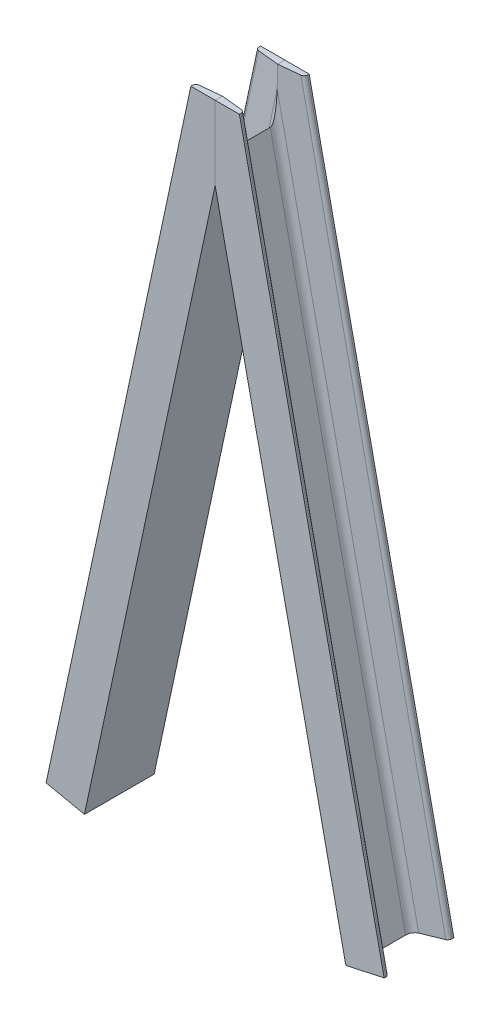
from build123d import *

# Parameters (mm, degrees)
C_START                               = -31.42936331
C_CHANNEL_CONFIGURED_80_X_8_1_DEPTH   = 715.891053164
C_CHANNEL_CONFIGURED_80_X_8_1_2_DEPTH = 80
C_START_2                             = 684.461689854
C_CHANNEL_CONFIGURED_80_X_8_1_3_DEPTH = 210.538310146
C_START_3                             = -684.461689854
C_CHANNEL_CONFIGURED_80_X_8_1_4_DEPTH = 715.891053164
C_CHANNEL_CONFIGURED_80_X_8_1_5_DEPTH = 80
C_START_4                             = -895
C_CHANNEL_CONFIGURED_80_X_8_1_6_DEPTH = 210.538310146
SKETCH12_W                            = 228.035854542
SKETCH12_H                            = 149.852132985
CUT_EXTRUDE1_DEPTH                    = 939.528461201


with BuildPart() as part:
    # C channel - configured 80 X 8(1): read off the stored shape, not the designer's step
    # C channel - configured 80 X 8(1) outline → C channel - configured 80 X 8(1) (new body)
    with BuildSketch(Plane(origin=(0, 0, 0), x_dir=(0.9778024140774096, -0.20952908873087298, 0), z_dir=(0.20952908873087295, 0.9778024140774098, 0)).offset(C_START)):
        with BuildLine():
            ThreePointArc((-188.088475965, -74.199337243), (-190.642941414, -75.500902399), (-191.670362112, -78.177424825))
            Line((-191.670362112, -78.177424825), (-191.670362112, -80))
            Line((-191.670362112, -80), (-146.670362112, -80))
            Line((-146.670362112, -80), (-146.670362112, 0))
            Line((-146.670362112, 0), (-191.670362112, 0))
            Line((-191.670362112, 0), (-191.670362112, -1.822575175))
            ThreePointArc((-191.670362112, -1.822575175), (-190.642941414, -4.499097601), (-188.088475965, -5.800662757))
            Line((-188.088475965, -5.800662757), (-159.334134405, -8.822865837))
            ThreePointArc((-159.334134405, -8.822865837), (-154.225203508, -11.425996149), (-152.170362112, -16.779041))
            Line((-152.170362112, -16.779041), (-152.170362112, -63.220959))
            ThreePointArc((-152.170362112, -63.220959), (-154.225203508, -68.574003851), (-159.334134405, -71.177134163))
            Line((-159.334134405, -71.177134163), (-188.088475965, -74.199337243))
        make_face()
    extrude(amount=C_CHANNEL_CONFIGURED_80_X_8_1_DEPTH)

    # C channel - configured 80 X 8_1 2 outlin → C channel - configured 80 X 8_1 2 (add)
    with BuildSketch(Plane.XY):
        Polygon((0, 914.767315949), (-44.001108633, 709.428808993), (0, 700), align=None)
    extrude(amount=C_CHANNEL_CONFIGURED_80_X_8_1_2_DEPTH)

    # C channel - configured 80 X 8_1 3 outlin → C channel - configured 80 X 8_1 3 (cut)
    with BuildSketch(Plane(origin=(0, 0, 0), x_dir=(0.9778024140774096, -0.20952908873087298, 0), z_dir=(0.20952908873087295, 0.9778024140774098, 0)).offset(C_START_2)):
        with BuildLine():
            Line((-191.670362112, -1.822575175), (-191.670362112, -78.177424825))
            ThreePointArc((-191.670362112, -78.177424825), (-190.642941414, -75.500902399), (-188.088475965, -74.199337243))
            Line((-188.088475965, -74.199337243), (-159.334134405, -71.177134163))
            ThreePointArc((-159.334134405, -71.177134163), (-154.225203508, -68.574003851), (-152.170362112, -63.220959))
            Line((-152.170362112, -63.220959), (-152.170362112, -16.779041))
            ThreePointArc((-152.170362112, -16.779041), (-154.225203508, -11.425996149), (-159.334134405, -8.822865837))
            Line((-159.334134405, -8.822865837), (-188.088475965, -5.800662757))
            ThreePointArc((-188.088475965, -5.800662757), (-190.642941414, -4.499097601), (-191.670362112, -1.822575175))
        make_face()
    extrude(amount=C_CHANNEL_CONFIGURED_80_X_8_1_3_DEPTH, mode=Mode.SUBTRACT)


with BuildPart() as body_2:
    # C channel - configured 80 X 8_1 4 outlin → C channel - configured 80 X 8_1 4 (new body)
    with BuildSketch(Plane(origin=(0, 0, 0), x_dir=(0.9778024140774096, 0.20952908873087298, 0), z_dir=(0.20952908873087295, -0.9778024140774098, 0)).offset(C_START_3)):
        with BuildLine():
            ThreePointArc((188.088475965, 74.199337243), (190.642941414, 75.500902399), (191.670362112, 78.177424825))
            Line((191.670362112, 78.177424825), (191.670362112, 80))
            Line((191.670362112, 80), (146.670362112, 80))
            Line((146.670362112, 80), (146.670362112, 0))
            Line((146.670362112, 0), (191.670362112, 0))
            Line((191.670362112, 0), (191.670362112, 1.822575175))
            ThreePointArc((191.670362112, 1.822575175), (190.642941414, 4.499097601), (188.088475965, 5.800662757))
            Line((188.088475965, 5.800662757), (159.334134405, 8.822865837))
            ThreePointArc((159.334134405, 8.822865837), (154.225203508, 11.425996149), (152.170362112, 16.779041))
            Line((152.170362112, 16.779041), (152.170362112, 63.220959))
            ThreePointArc((152.170362112, 63.220959), (154.225203508, 68.574003851), (159.334134405, 71.177134163))
            Line((159.334134405, 71.177134163), (188.088475965, 74.199337243))
        make_face()
    extrude(amount=C_CHANNEL_CONFIGURED_80_X_8_1_4_DEPTH)

    # C channel - configured 80 X 8_1 5 outlin → C channel - configured 80 X 8_1 5 (add)
    with BuildSketch(Plane.XY):
        Polygon((44.001108633, 709.428808993), (0, 914.767315949), (0, 700), align=None)
    extrude(amount=C_CHANNEL_CONFIGURED_80_X_8_1_5_DEPTH)

    # C channel - configured 80 X 8_1 6 outlin → C channel - configured 80 X 8_1 6 (cut)
    with BuildSketch(Plane(origin=(0, 0, 0), x_dir=(0.9778024140774096, 0.20952908873087298, 0), z_dir=(0.20952908873087295, -0.9778024140774098, 0)).offset(C_START_4)):
        with BuildLine():
            Line((191.670362112, 1.822575175), (191.670362112, 78.177424825))
            ThreePointArc((191.670362112, 78.177424825), (190.642941414, 75.500902399), (188.088475965, 74.199337243))
            Line((188.088475965, 74.199337243), (159.334134405, 71.177134163))
            ThreePointArc((159.334134405, 71.177134163), (154.225203508, 68.574003851), (152.170362112, 63.220959))
            Line((152.170362112, 63.220959), (152.170362112, 16.779041))
            ThreePointArc((152.170362112, 16.779041), (154.225203508, 11.425996149), (159.334134405, 8.822865837))
            Line((159.334134405, 8.822865837), (188.088475965, 5.800662757))
            ThreePointArc((188.088475965, 5.800662757), (190.642941414, 4.499097601), (191.670362112, 1.822575175))
        make_face()
    extrude(amount=C_CHANNEL_CONFIGURED_80_X_8_1_6_DEPTH, mode=Mode.SUBTRACT)


with BuildPart() as cut_extrude1_tool:
    # Sketch12 → Cut-Extrude1 (new, through all)
    with BuildSketch(Plane(origin=(0, 0, 0), x_dir=(-1, 0, 0), z_dir=(0, 0, -1))):
        with Locations((-7.945995122, 859.693382442)):
            Rectangle(SKETCH12_W, SKETCH12_H)
    extrude(amount=-CUT_EXTRUDE1_DEPTH)


with BuildPart() as part_1:
    add(part.part)

    # Cut-Extrude1: cut by cut_extrude1_tool
    add(cut_extrude1_tool.part, mode=Mode.SUBTRACT)


with BuildPart() as body_2_1:
    add(body_2.part)

    # Cut-Extrude1: cut by cut_extrude1_tool
    add(cut_extrude1_tool.part, mode=Mode.SUBTRACT)


solid = Compound([part_1.part, body_2_1.part])
